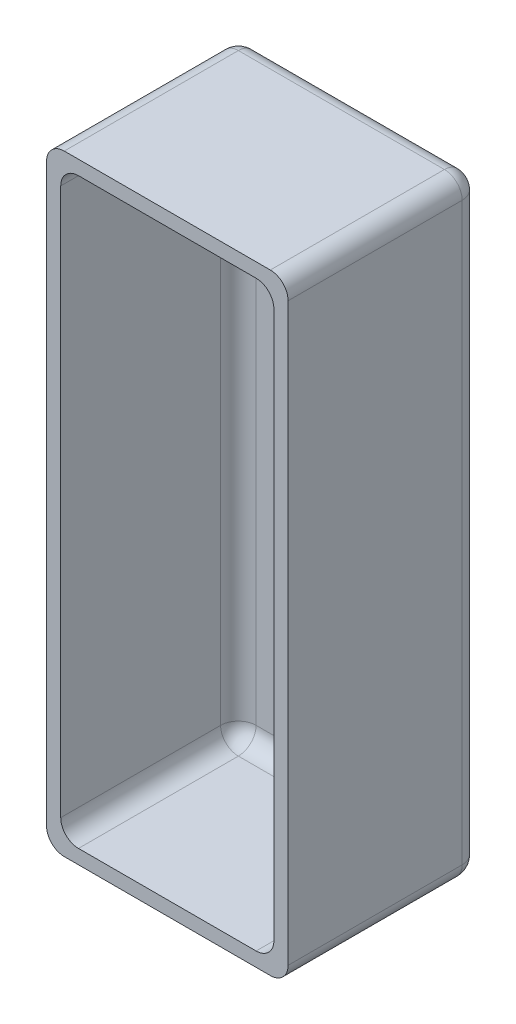
from build123d import *

# Parameters (mm, degrees)
ESQUISSE1_W        = 30
ESQUISSE1_H        = 82
BOSS_EXTRU_1_DEPTH = 25
COQUE1_T           = 2
CONG_1_R           = 2.5


with BuildPart() as part:
    # Esquisse1 → Boss.-Extru.1 (new body)
    with BuildSketch(Plane.XY):
        Rectangle(ESQUISSE1_W, ESQUISSE1_H)
    extrude(amount=BOSS_EXTRU_1_DEPTH)

    # Coque1
    coque1_openings = [part.faces().sort_by_distance(p)[0] for p in [
        (0, 0, 25),
    ]]
    offset(amount=COQUE1_T, openings=coque1_openings, kind=Kind.INTERSECTION)

    # Congé1
    # the kernel refuses this fillet: 2.5 mm, written as the material it adds along each edge
    with BuildSketch(Plane(origin=(-12.5, -38.5, 2.5), x_dir=(-1, 0, 0), z_dir=(0, -1, 0))) as cong_1_piece_1_section:
        Polygon((0, 0), (CONG_1_R, 0), (CONG_1_R, CONG_1_R), (0, CONG_1_R), align=None)
    cong_1_piece_1 = extrude(amount=CONG_1_R, mode=Mode.PRIVATE)
    cong_1_piece_1 = cong_1_piece_1 - Plane(origin=(-12.5, -38.5, 2.5), x_dir=(0.7071067811865475, 0, 0.7071067811865475), z_dir=(0, -1, 0)) * Sphere(CONG_1_R, mode=Mode.PRIVATE)
    add(cong_1_piece_1)
    with BuildSketch(Plane(origin=(-12.5, 38.5, 2.5), x_dir=(0, 1, 0), z_dir=(-1, 0, 0))) as cong_1_piece_2_section:
        Polygon((0, 0), (CONG_1_R, 0), (CONG_1_R, CONG_1_R), (0, CONG_1_R), align=None)
    cong_1_piece_2 = extrude(amount=CONG_1_R, mode=Mode.PRIVATE)
    cong_1_piece_2 = cong_1_piece_2 - Plane(origin=(-12.5, 38.5, 2.5), x_dir=(0, -0.7071067811865475, 0.7071067811865475), z_dir=(-1, 0, 0)) * Sphere(CONG_1_R, mode=Mode.PRIVATE)
    add(cong_1_piece_2)
    with BuildSketch(Plane(origin=(12.5, -38.5, 2.5), x_dir=(1, 0, 0), z_dir=(0, -1, 0))) as cong_1_piece_3_section:
        Polygon((0, 0), (CONG_1_R, 0), (CONG_1_R, -CONG_1_R), (0, -CONG_1_R), align=None)
    cong_1_piece_3 = extrude(amount=CONG_1_R, mode=Mode.PRIVATE)
    cong_1_piece_3 = cong_1_piece_3 - Plane(origin=(12.5, -38.5, 2.5), x_dir=(-0.7071067811865475, 0, 0.7071067811865475), z_dir=(0, -1, 0)) * Sphere(CONG_1_R, mode=Mode.PRIVATE)
    add(cong_1_piece_3)
    with BuildSketch(Plane(origin=(12.5, 38.5, 2.5), x_dir=(1, 0, 0), z_dir=(0, 1, 0))) as cong_1_piece_4_section:
        Polygon((0, 0), (CONG_1_R, 0), (CONG_1_R, CONG_1_R), (0, CONG_1_R), align=None)
    cong_1_piece_4 = extrude(amount=CONG_1_R, mode=Mode.PRIVATE)
    cong_1_piece_4 = cong_1_piece_4 - Plane(origin=(12.5, 38.5, 2.5), x_dir=(-0.7071067811865475, 0, 0.7071067811865475), z_dir=(0, 1, 0)) * Sphere(CONG_1_R, mode=Mode.PRIVATE)
    add(cong_1_piece_4)
    with BuildSketch(Plane(origin=(-15, -38.5, 0), x_dir=(0, 0, 1), z_dir=(0, 1, 0)), Plane(origin=(15, 38.5, 0), x_dir=(0, 0, 1), z_dir=(0, -1, 0))) as cong_1_piece_5:
        with BuildLine():
            CenterArc((CONG_1_R, CONG_1_R), CONG_1_R, 180, 90)
            Line((0, CONG_1_R), (0, 0))
            Line((0, 0), (CONG_1_R, 0))
        make_face()
    extrude(amount=77)
    with BuildSketch(Plane(origin=(-15, 41, 2.5), x_dir=(0, -1, 0), z_dir=(0, 0, 1)), Plane(origin=(-15, -41, 2.5), x_dir=(1, 0, 0), z_dir=(0, 0, 1)), Plane(origin=(15, 41, 2.5), x_dir=(-1, 0, 0), z_dir=(0, 0, 1))) as cong_1_piece_6:
        with BuildLine():
            CenterArc((CONG_1_R, CONG_1_R), CONG_1_R, 180, 90)
            Line((0, CONG_1_R), (0, 0))
            Line((0, 0), (CONG_1_R, 0))
        make_face()
    extrude(amount=22.5)
    with BuildSketch(Plane(origin=(12.5, -41, 0), x_dir=(0, 0, 1), z_dir=(-1, 0, 0)), Plane(origin=(-12.5, 41, 0), x_dir=(0, 0, 1), z_dir=(1, 0, 0))) as cong_1_piece_7:
        with BuildLine():
            CenterArc((CONG_1_R, CONG_1_R), CONG_1_R, 180, 90)
            Line((0, CONG_1_R), (0, 0))
            Line((0, 0), (CONG_1_R, 0))
        make_face()
    extrude(amount=25)
    with BuildSketch(Plane(origin=(15, -41, 2.5), x_dir=(-1, 0, 0), z_dir=(0, 0, 1))) as cong_1_piece_8:
        with BuildLine():
            CenterArc((CONG_1_R, -CONG_1_R), CONG_1_R, 90, 90)
            Line((0, -CONG_1_R), (0, 0))
            Line((0, 0), (CONG_1_R, 0))
        make_face()
    extrude(amount=22.5)
    # the kernel refuses this fillet: 2.5 mm, written as the material it takes off along each edge
    with BuildSketch(Plane(origin=(14.5, 40.5, 0.5), x_dir=(0, 0, -1), z_dir=(0, 1, 0))) as cong_1_2_piece_1_section:
        Polygon((0, 0), (CONG_1_R, 0), (CONG_1_R, -CONG_1_R), (0, -CONG_1_R), align=None)
    cong_1_2_piece_1 = extrude(amount=CONG_1_R, mode=Mode.PRIVATE)
    cong_1_2_piece_1 = cong_1_2_piece_1 - Plane(origin=(14.5, 40.5, 0.5), x_dir=(-0.7071067811865475, 0, 0.7071067811865475), z_dir=(0, 1, 0)) * Sphere(CONG_1_R, mode=Mode.PRIVATE)
    add(cong_1_2_piece_1, mode=Mode.SUBTRACT)
    with BuildSketch(Plane(origin=(-14.5, 40.5, 0.5), x_dir=(0, 0, -1), z_dir=(0, 1, 0))) as cong_1_2_piece_2_section:
        Polygon((0, 0), (CONG_1_R, 0), (CONG_1_R, CONG_1_R), (0, CONG_1_R), align=None)
    cong_1_2_piece_2 = extrude(amount=CONG_1_R, mode=Mode.PRIVATE)
    cong_1_2_piece_2 = cong_1_2_piece_2 - Plane(origin=(-14.5, 40.5, 0.5), x_dir=(0.7071067811865475, 0, 0.7071067811865475), z_dir=(0, 1, 0)) * Sphere(CONG_1_R, mode=Mode.PRIVATE)
    add(cong_1_2_piece_2, mode=Mode.SUBTRACT)
    with BuildSketch(Plane(origin=(14.5, -40.5, 0.5), x_dir=(1, 0, 0), z_dir=(0, -1, 0))) as cong_1_2_piece_3_section:
        Polygon((0, 0), (CONG_1_R, 0), (CONG_1_R, -CONG_1_R), (0, -CONG_1_R), align=None)
    cong_1_2_piece_3 = extrude(amount=CONG_1_R, mode=Mode.PRIVATE)
    cong_1_2_piece_3 = cong_1_2_piece_3 - Plane(origin=(14.5, -40.5, 0.5), x_dir=(-0.7071067811865475, 0, 0.7071067811865475), z_dir=(0, -1, 0)) * Sphere(CONG_1_R, mode=Mode.PRIVATE)
    add(cong_1_2_piece_3, mode=Mode.SUBTRACT)
    with BuildSketch(Plane(origin=(-14.5, -40.5, 0.5), x_dir=(0, -1, 0), z_dir=(0, 0, -1))) as cong_1_2_piece_4_section:
        Polygon((0, 0), (CONG_1_R, 0), (CONG_1_R, CONG_1_R), (0, CONG_1_R), align=None)
    cong_1_2_piece_4 = extrude(amount=CONG_1_R, mode=Mode.PRIVATE)
    cong_1_2_piece_4 = cong_1_2_piece_4 - Plane(origin=(-14.5, -40.5, 0.5), x_dir=(0.7071067811865475, 0.7071067811865476, 0), z_dir=(0, 0, -1)) * Sphere(CONG_1_R, mode=Mode.PRIVATE)
    add(cong_1_2_piece_4, mode=Mode.SUBTRACT)
    with BuildSketch(Plane(origin=(14.5, 43, -2), x_dir=(0, 0, 1), z_dir=(-1, 0, 0)), Plane(origin=(-14.5, -43, -2), x_dir=(0, 0, 1), z_dir=(1, 0, 0))) as cong_1_2_piece_5:
        with BuildLine():
            CenterArc((CONG_1_R, -CONG_1_R), CONG_1_R, 90, 90)
            Line((0, -CONG_1_R), (0, 0))
            Line((0, 0), (CONG_1_R, 0))
        make_face()
    extrude(amount=29, mode=Mode.SUBTRACT)
    with BuildSketch(Plane(origin=(17, -40.5, -2), x_dir=(0, 0, 1), z_dir=(0, 1, 0)), Plane(origin=(-17, 40.5, -2), x_dir=(0, 0, 1), z_dir=(0, -1, 0))) as cong_1_2_piece_6:
        with BuildLine():
            CenterArc((CONG_1_R, -CONG_1_R), CONG_1_R, 90, 90)
            Line((0, -CONG_1_R), (0, 0))
            Line((0, 0), (CONG_1_R, 0))
        make_face()
    extrude(amount=81, mode=Mode.SUBTRACT)
    with BuildSketch(Plane(origin=(-17, 43, 31.25), x_dir=(1, 0, 0), z_dir=(0, 0, -1)), Plane(origin=(17, -43, 0.5), x_dir=(0, 1, 0), z_dir=(0, 0, 1))) as cong_1_2_piece_7:
        with BuildLine():
            CenterArc((CONG_1_R, CONG_1_R), CONG_1_R, 180, 90)
            Line((0, CONG_1_R), (0, 0))
            Line((0, 0), (CONG_1_R, 0))
        make_face()
    extrude(amount=30.75, mode=Mode.SUBTRACT)
    with BuildSketch(Plane(origin=(17, 43, 31.25), x_dir=(-1, 0, 0), z_dir=(0, 0, -1)), Plane(origin=(-17, -43, 31.25), x_dir=(1, 0, 0), z_dir=(0, 0, -1))) as cong_1_2_piece_8:
        with BuildLine():
            CenterArc((CONG_1_R, -CONG_1_R), CONG_1_R, 90, 90)
            Line((0, -CONG_1_R), (0, 0))
            Line((0, 0), (CONG_1_R, 0))
        make_face()
    extrude(amount=30.75, mode=Mode.SUBTRACT)


solid = part.part
